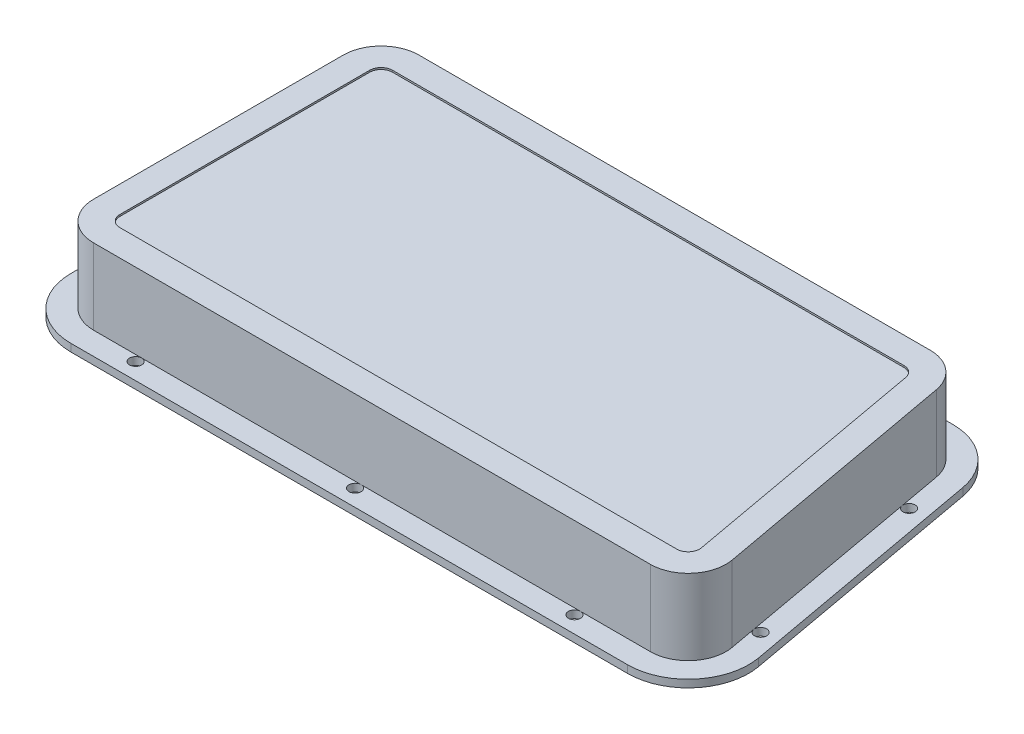
from build123d import *

# Parameters (mm, degrees)
SURFACE_EXTRUDE1_1_DEPTH = 100
THICKEN1_T1              = 30
SURFACE_EXTRUDE5_2_DEPTH = 10.000000066
THICKEN4_T1              = 29.999999944
THICKEN4_T2              = 29.999999944
SKETCH10_R               = 8
CUT_EXTRUDE1_DEPTH       = 83.660000066
THICKEN7_START           = 97.714
THICKEN7_DEPTH           = 2.286
THICKEN8_START           = -10.000000066
THICKEN8_DEPTH           = 2.286
THICKEN9_START           = -7.713999964
THICKEN9_DEPTH           = 105.427999964


# Read off the part's stored shape, not the designer's step: Thicken7, Thicken8, Thicken9
with BuildPart() as body_1:
    # Surface-Extrude1: a surface, the sketch's curves swept straight by 100 mm
    with BuildLine(Plane(origin=(0, 0, 0), x_dir=(1, 0, 0), z_dir=(0, 1, 0)), mode=Mode.PRIVATE) as surface_extrude1_1_path:
        Line((-486.756814761, 147.686739346), (-486.756814761, -182.313260654))
        ThreePointArc((-486.756814761, -182.313260654), (-472.112153821, -217.668599714), (-436.756814761, -232.313260654))
        Line((-436.756814761, -232.313260654), (299.049689734, -232.313260654))
        ThreePointArc((299.049689734, -232.313260654), (337.43727624, -214.350632617), (348.243185239, -173.368988744))
        Line((348.243185239, -173.368988744), (288.243185239, 156.631011256))
        ThreePointArc((288.243185239, 156.631011256), (271.087061696, 186.074325852), (239.049689734, 197.686739346))
        Line((239.049689734, 197.686739346), (-436.756814761, 197.686739346))
        ThreePointArc((-436.756814761, 197.686739346), (-472.112153821, 183.042078405), (-486.756814761, 147.686739346))
    surface_extrude1_1 = Shell.extrude(surface_extrude1_1_path.wire(), (0 * SURFACE_EXTRUDE1_1_DEPTH, 1 * SURFACE_EXTRUDE1_1_DEPTH, 0 * SURFACE_EXTRUDE1_1_DEPTH))
    add(Solid.thicken(surface_extrude1_1, THICKEN1_T1))

    # Surface-Extrude5: a surface, the sketch's curves swept straight by 10.000000066 mm
    with BuildLine(Plane.XZ, mode=Mode.PRIVATE) as surface_extrude5_2_path:
        Line((-436.756814761, 232.313260654), (299.049689734, 232.313260654))
        ThreePointArc((299.049689734, 232.313260654), (337.43727624, 214.350632617), (348.243185239, 173.368988744))
        Line((348.243185239, 173.368988744), (288.243185239, -156.631011256))
        ThreePointArc((288.243185239, -156.631011256), (271.087061696, -186.074325852), (239.049689734, -197.686739346))
        Line((239.049689734, -197.686739346), (-436.756814761, -197.686739346))
        ThreePointArc((-436.756814761, -197.686739346), (-472.112153821, -183.042078405), (-486.756814761, -147.686739346))
        Line((-486.756814761, -147.686739346), (-486.756814761, 182.313260654))
        ThreePointArc((-486.756814761, 182.313260654), (-472.112153821, 217.668599714), (-436.756814761, 232.313260654))
    surface_extrude5_2 = Shell.extrude(surface_extrude5_2_path.wire(), (0 * SURFACE_EXTRUDE5_2_DEPTH, -1 * SURFACE_EXTRUDE5_2_DEPTH, 0 * SURFACE_EXTRUDE5_2_DEPTH))
    add(Solid.thicken(surface_extrude5_2, THICKEN4_T1))
    add(Solid.thicken(surface_extrude5_2, -THICKEN4_T2))

    # Sketch10 → Cut-Extrude1 (cut)
    with BuildSketch(Plane.XZ.offset(10.000000066)):
        with Locations(Location((206.802218777, -205.686739346, 0), (0, 0, 270))):
            Circle(SKETCH10_R)
        with Locations(Location((-83.197781105, -205.686739346, 0), (0, 0, 270))):
            Circle(SKETCH10_R)
        with Locations(Location((-373.197780987, -205.686739346, 0), (0, 0, 270))):
            Circle(SKETCH10_R)
        with Locations(Location((-494.756814761, -102.701739346, 0), (0, 0, 270))):
            Circle(SKETCH10_R)
        with Locations(Location((-494.756814761, 137.328260654, 0), (0, 0, 270))):
            Circle(SKETCH10_R)
        with Locations(Location((306.185118221, -102.671739406, 0), (0, 0, 270))):
            Circle(SKETCH10_R)
        with Locations(Location((349.821481868, 137.328260654, 0), (0, 0, 270))):
            Circle(SKETCH10_R)
        with Locations(Location((-83.197781105, 240.313260654, 0), (0, 0, 270))):
            Circle(SKETCH10_R)
        with Locations(Location((-373.197780987, 240.313260654, 0), (0, 0, 270))):
            Circle(SKETCH10_R)
        with Locations(Location((206.802218777, 240.313260654, 0), (0, 0, 270))):
            Circle(SKETCH10_R)
    extrude(amount=-CUT_EXTRUDE1_DEPTH, mode=Mode.SUBTRACT)

    # Thicken7 outline → Thicken7 (add)
    with BuildSketch(Plane(origin=(0, 0, 0), x_dir=(1, 0, 0), z_dir=(0, 1, 0)).offset(THICKEN7_START)):
        with BuildLine():
            Line((-436.756814761, -202.313260654), (299.049689734, -202.313260654))
            ThreePointArc((299.049689734, -202.313260654), (314.404724336, -195.128209439), (318.727087936, -178.73555189))
            Line((318.727087936, -178.73555189), (258.727087936, 151.26444811))
            ThreePointArc((258.727087936, 151.26444811), (251.864638519, 163.041773948), (239.049689734, 167.686739346))
            Line((239.049689734, 167.686739346), (-436.756814761, 167.686739346))
            ThreePointArc((-436.756814761, 167.686739346), (-450.898950384, 161.828874969), (-456.756814761, 147.686739346))
            Line((-456.756814761, 147.686739346), (-456.756814761, -182.313260654))
            ThreePointArc((-456.756814761, -182.313260654), (-450.898950385, -196.455396278), (-436.756814761, -202.313260654))
        make_face()
        with BuildLine():
            Line((299.049689734, -197.473260654), (-436.756814761, -197.473260654))
            ThreePointArc((-436.756814761, -197.473260654), (-447.476553564, -193.032999457), (-451.916814761, -182.313260654))
            Line((-451.916814761, -182.313260654), (-451.916814761, 147.686739346))
            ThreePointArc((-451.916814761, 147.686739346), (-447.476553564, 158.406478149), (-436.756814761, 162.846739346))
            Line((-436.756814761, 162.846739346), (239.049689734, 162.846739346))
            ThreePointArc((239.049689734, 162.846739346), (248.763420913, 159.325855574), (253.965157571, 150.398642589))
            Line((253.965157571, 150.398642589), (313.965157571, -179.601357411))
            ThreePointArc((313.965157571, -179.601357411), (310.688805962, -192.026991833), (299.049689734, -197.473260654))
        make_face(mode=Mode.SUBTRACT)
    extrude(amount=THICKEN7_DEPTH)

    # Thicken8 outline → Thicken8 (add)
    with BuildSketch(Plane(origin=(0, 0, 0), x_dir=(1, 0, 0), z_dir=(0, 1, 0)).offset(THICKEN8_START)):
        with BuildLine():
            Line((-436.756814761, -202.313260654), (299.049689734, -202.313260654))
            ThreePointArc((299.049689734, -202.313260654), (314.404724336, -195.128209439), (318.727087936, -178.73555189))
            Line((318.727087936, -178.73555189), (258.727087936, 151.26444811))
            ThreePointArc((258.727087936, 151.26444811), (251.864638519, 163.041773948), (239.049689734, 167.686739346))
            Line((239.049689734, 167.686739346), (-436.756814761, 167.686739346))
            ThreePointArc((-436.756814761, 167.686739346), (-450.898950384, 161.828874969), (-456.756814761, 147.686739346))
            Line((-456.756814761, 147.686739346), (-456.756814761, -182.313260654))
            ThreePointArc((-456.756814761, -182.313260654), (-450.898950385, -196.455396278), (-436.756814761, -202.313260654))
        make_face()
        with BuildLine():
            ThreePointArc((-436.756814761, -197.473260738), (-447.476553623, -193.032999517), (-451.916814845, -182.313260654))
            Line((-451.916814845, -182.313260654), (-451.916814845, 147.686739346))
            ThreePointArc((-451.916814845, 147.686739346), (-447.476553623, 158.406478208), (-436.756814761, 162.84673943))
            Line((-436.756814761, 162.84673943), (239.049689734, 162.84673943))
            ThreePointArc((239.049689734, 162.84673943), (248.763420967, 159.325855639), (253.965157654, 150.398642604))
            Line((253.965157654, 150.398642604), (313.965157654, -179.601357396))
            ThreePointArc((313.965157654, -179.601357396), (310.688806027, -192.026991887), (299.049689734, -197.473260738))
            Line((299.049689734, -197.473260738), (-436.756814761, -197.473260738))
        make_face(mode=Mode.SUBTRACT)
    extrude(amount=THICKEN8_DEPTH)


with BuildPart() as body_2:
    # Thicken9 outline → Thicken9 (new body)
    with BuildSketch(Plane(origin=(0, 0, 0), x_dir=(1, 0, 0), z_dir=(0, 1, 0)).offset(THICKEN9_START)):
        with BuildLine():
            ThreePointArc((258.727087936, 151.26444811), (251.864638519, 163.041773948), (239.049689734, 167.686739346))
            Line((239.049689734, 167.686739346), (-436.756814761, 167.686739346))
            ThreePointArc((-436.756814761, 167.686739346), (-450.898950384, 161.828874969), (-456.756814761, 147.686739346))
            Line((-456.756814761, 147.686739346), (-456.756814761, -182.313260654))
            ThreePointArc((-456.756814761, -182.313260654), (-450.898950385, -196.455396278), (-436.756814761, -202.313260654))
            Line((-436.756814761, -202.313260654), (299.049689734, -202.313260654))
            ThreePointArc((299.049689734, -202.313260654), (314.404724336, -195.128209439), (318.727087936, -178.73555189))
            Line((318.727087936, -178.73555189), (258.727087936, 151.26444811))
        make_face()
    extrude(amount=THICKEN9_DEPTH)


solid = Compound([body_1.part, body_2.part])
